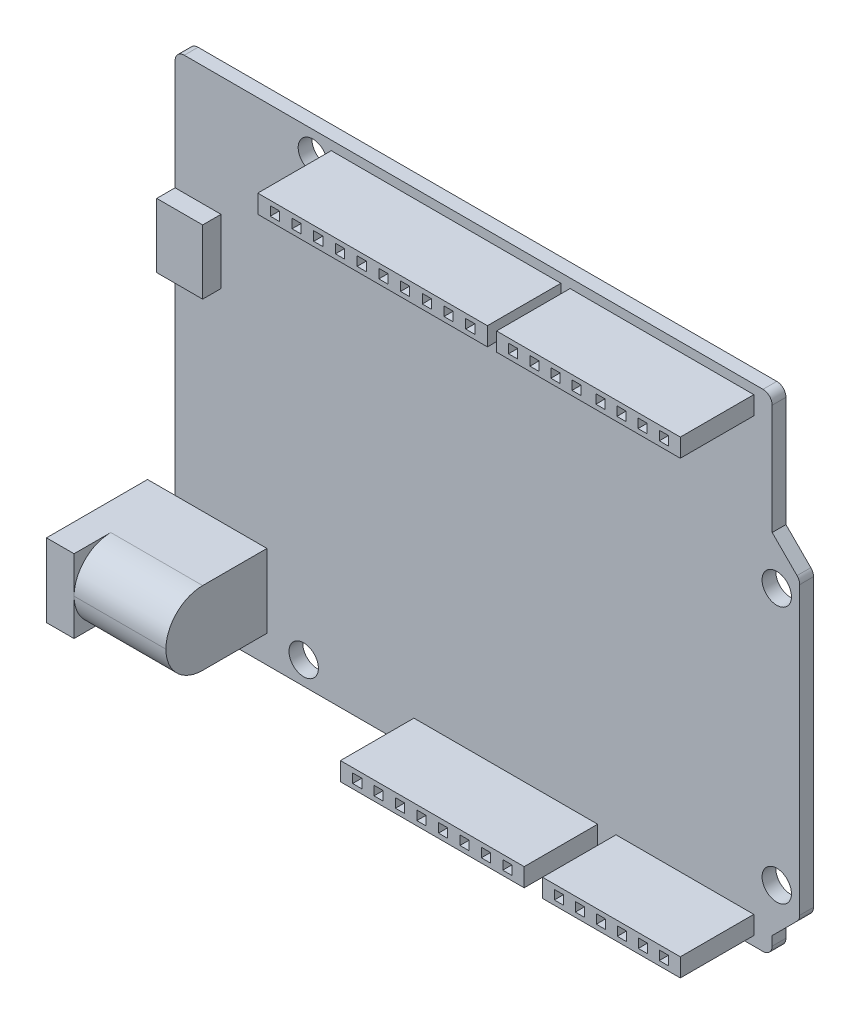
from build123d import *

# Parameters (mm, degrees)
BOSS_EXTRU_1_DEPTH      = 1.5
ESQUISSE2_R             = 1.6
ENL_V_MAT_EXTRU_1_DEPTH = 2
ESQUISSE6_W             = 10
ESQUISSE6_H             = 8
BOSS_EXTRU_2_DEPTH      = 11
CONG_1_R                = 4
ESQUISSE7_W             = 11
ESQUISSE7_H             = 8
BOSS_EXTRU_3_DEPTH      = 3
ESQUISSE8_R             = 3
ENL_V_MAT_EXTRU_2_DEPTH = 10
ESQUISSE9_R             = 1
BOSS_EXTRU_4_DEPTH      = 8
CONG_3_R                = 0.4
ESQUISSE10_W            = 5
ESQUISSE10_H            = 7
BOSS_EXTRU_5_DEPTH      = 2
ESQUISSE11_W            = 1.8
ESQUISSE11_H            = 6.8
ENL_V_MAT_EXTRU_3_DEPTH = 4
ESQUISSE14_W            = 0.3
ESQUISSE14_H            = 3
BOSS_EXTRU_6_DEPTH      = 3.5
ESQUISSE15_W            = 20
ESQUISSE15_H            = 2
ESQUISSE15_W_2          = 15
ESQUISSE15_W_3          = 25
BOSS_EXTRU_7_DEPTH      = 8
ESQUISSE17_W            = 1
ESQUISSE17_H            = 1
ESQUISSE17_W_2          = 0.986443786
ESQUISSE17_W_3          = 0.968508445
ESQUISSE17_W_4          = 0.986443787
ENL_V_MAT_EXTRU_4_DEPTH = 5
CONG_4_R                = 1


with BuildPart() as part:
    # Esquisse1 → Boss.-Extru.1 (new body)
    with BuildSketch(Plane.XY):
        Polygon((0, 0), (0, 53), (65, 53), (65, 40), (68, 37), (68, 5), (65, 2), (65, 0), align=None)
    extrude(amount=BOSS_EXTRU_1_DEPTH)

    # Esquisse2 → Enlèv. mat.-Extru.1 (cut)
    with BuildSketch(Plane.XY.offset(1.5)):
        with Locations((15, 50.5)):
            Circle(ESQUISSE2_R)
        with Locations((65.5, 7)):
            Circle(ESQUISSE2_R)
        with Locations((65.5, 34.98933109)):
            Circle(ESQUISSE2_R)
        with Locations((14, 2.5)):
            Circle(ESQUISSE2_R)
    extrude(amount=-ENL_V_MAT_EXTRU_1_DEPTH, mode=Mode.SUBTRACT)

    # Esquisse6 → Boss.-Extru.2 (add)
    with BuildSketch(Plane.XY.offset(1.5)):
        with Locations((5, 7)):
            Rectangle(ESQUISSE6_W, ESQUISSE6_H)
    extrude(amount=BOSS_EXTRU_2_DEPTH)

    # Congé1
    cong_1_edges = [part.edges().sort_by_distance(p)[0] for p in [
        (5, 11, 12.5),
        (5, 3, 12.5),
    ]]
    fillet(cong_1_edges, radius=CONG_1_R - 0.0001)  # a hair under: the kernel refuses the full size

    # Esquisse7 → Boss.-Extru.3 (add)
    with BuildSketch(Plane.ZY):
        with Locations((7, 7)):
            Rectangle(ESQUISSE7_W, ESQUISSE7_H)
    extrude(amount=BOSS_EXTRU_3_DEPTH)

    # Esquisse8 → Enlèv. mat.-Extru.2 (cut)
    with BuildSketch(Plane.ZY.offset(3)):
        with Locations((7.5, 7)):
            Circle(ESQUISSE8_R)
    extrude(amount=-ENL_V_MAT_EXTRU_2_DEPTH, mode=Mode.SUBTRACT)

    # Esquisse9 → Boss.-Extru.4 (add)
    with BuildSketch(Plane.ZY.offset(-7)):
        with Locations((7.5, 7)):
            Circle(ESQUISSE9_R)
    extrude(amount=BOSS_EXTRU_4_DEPTH)

    # Congé3
    cong_3_edges = [part.edges().sort_by_distance(p)[0] for p in [
        (-1, 7, 6.5),
    ]]
    fillet(cong_3_edges, radius=CONG_3_R)

    # Esquisse10 → Boss.-Extru.5 (add)
    with BuildSketch(Plane.XY.offset(1.5)):
        with Locations((2.5, 36.5)):
            Rectangle(ESQUISSE10_W, ESQUISSE10_H)
    extrude(amount=BOSS_EXTRU_5_DEPTH)

    # Esquisse11 → Enlèv. mat.-Extru.3 (cut)
    with BuildSketch(Plane.ZY):
        with Locations((2.5, 36.5)):
            Rectangle(ESQUISSE11_W, ESQUISSE11_H)
    extrude(amount=-ENL_V_MAT_EXTRU_3_DEPTH, mode=Mode.SUBTRACT)

    # Esquisse14 → Boss.-Extru.6 (add)
    with BuildSketch(Plane.ZY.offset(-4)):
        with Locations((2.75, 36.5)):
            Rectangle(ESQUISSE14_W, ESQUISSE14_H)
    extrude(amount=BOSS_EXTRU_6_DEPTH)

    # Esquisse15 → Boss.-Extru.7 (add)
    with BuildSketch(Plane.XY.offset(1.5)):
        with Locations((36, 2)):
            Rectangle(ESQUISSE15_W, ESQUISSE15_H)
        with Locations((55.5, 2)):
            Rectangle(ESQUISSE15_W_2, ESQUISSE15_H)
        with Locations((29.5, 51)):
            Rectangle(ESQUISSE15_W_3, ESQUISSE15_H)
        with Locations((53, 51)):
            Rectangle(ESQUISSE15_W, ESQUISSE15_H)
    extrude(amount=BOSS_EXTRU_7_DEPTH)

    # Esquisse17 → Enlèv. mat.-Extru.4 (cut)
    with BuildSketch(Plane.XY.offset(9.5)):
        with Locations((27.83, 2)):
            Rectangle(ESQUISSE17_W, ESQUISSE17_H)
        with Locations((30.16, 2)):
            Rectangle(ESQUISSE17_W, ESQUISSE17_H)
        with Locations((32.49, 2)):
            Rectangle(ESQUISSE17_W, ESQUISSE17_H)
        with Locations((34.82, 2)):
            Rectangle(ESQUISSE17_W, ESQUISSE17_H)
        with Locations((37.18, 2)):
            Rectangle(ESQUISSE17_W, ESQUISSE17_H)
        with Locations((39.51, 2)):
            Rectangle(ESQUISSE17_W, ESQUISSE17_H)
        with Locations((41.84, 2)):
            Rectangle(ESQUISSE17_W, ESQUISSE17_H)
        with Locations((44.17, 2)):
            Rectangle(ESQUISSE17_W, ESQUISSE17_H)
        with Locations((49.786, 2)):
            Rectangle(ESQUISSE17_W, ESQUISSE17_H)
        with Locations((52.072, 2)):
            Rectangle(ESQUISSE17_W, ESQUISSE17_H)
        with Locations((54.358, 2)):
            Rectangle(ESQUISSE17_W, ESQUISSE17_H)
        with Locations((56.642, 2)):
            Rectangle(ESQUISSE17_W, ESQUISSE17_H)
        with Locations((58.928, 2)):
            Rectangle(ESQUISSE17_W, ESQUISSE17_H)
        with Locations((61.214, 2)):
            Rectangle(ESQUISSE17_W, ESQUISSE17_H)
        with Locations((18.864, 51)):
            Rectangle(ESQUISSE17_W, ESQUISSE17_H)
        with Locations((21.228, 51)):
            Rectangle(ESQUISSE17_W, ESQUISSE17_H)
        with Locations((23.592, 51)):
            Rectangle(ESQUISSE17_W, ESQUISSE17_H)
        with Locations((25.956, 51)):
            Rectangle(ESQUISSE17_W, ESQUISSE17_H)
        with Locations((28.32, 51)):
            Rectangle(ESQUISSE17_W, ESQUISSE17_H)
        with Locations((30.68, 51)):
            Rectangle(ESQUISSE17_W, ESQUISSE17_H)
        with Locations((33.044, 51)):
            Rectangle(ESQUISSE17_W, ESQUISSE17_H)
        with Locations((35.408, 51)):
            Rectangle(ESQUISSE17_W, ESQUISSE17_H)
        with Locations((37.772, 51)):
            Rectangle(ESQUISSE17_W, ESQUISSE17_H)
        with Locations((40.136, 51)):
            Rectangle(ESQUISSE17_W, ESQUISSE17_H)
        with Locations((44.794646, 51)):
            Rectangle(ESQUISSE17_W_2, ESQUISSE17_H)
        with Locations((47.117272735, 51)):
            Rectangle(ESQUISSE17_W_3, ESQUISSE17_H)
        with Locations((49.404028786, 51)):
            Rectangle(ESQUISSE17_W_2, ESQUISSE17_H)
        with Locations((51.699752509, 51)):
            Rectangle(ESQUISSE17_W_4, ESQUISSE17_H)
        with Locations((54.300247492, 51)):
            Rectangle(ESQUISSE17_W_4, ESQUISSE17_H)
        with Locations((56.595971214, 51)):
            Rectangle(ESQUISSE17_W_2, ESQUISSE17_H)
        with Locations((58.882727266, 51)):
            Rectangle(ESQUISSE17_W_3, ESQUISSE17_H)
        with Locations((61.205354, 51)):
            Rectangle(ESQUISSE17_W_2, ESQUISSE17_H)
    extrude(amount=-ENL_V_MAT_EXTRU_4_DEPTH, mode=Mode.SUBTRACT)

    # Congé4
    cong_4_edges = [part.edges().sort_by_distance(p)[0] for p in [
        (0, 0, 0.75),
        (65, 0, 0.75),
        (68, 5, 0.75),
        (68, 37, 0.75),
        (65, 53, 0.75),
        (0, 53, 0.75),
    ]]
    fillet(cong_4_edges, radius=CONG_4_R)


solid = part.part
